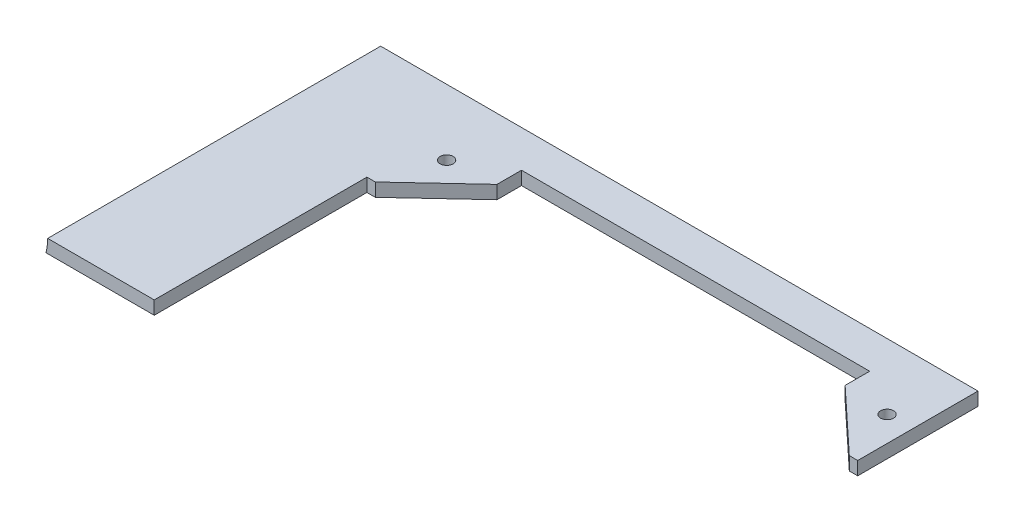
from build123d import *

# Parameters (mm, degrees)
SKETCH1_W            = 190.5
SKETCH1_H            = 76.2
BOSS_EXTRUDE1_DEPTH  = 3.175
SKETCH2_R            = 1.545336663
CUT_EXTRUDE4_DEPTH   = 103.636509708
SKETCH3_W            = 153.75
SKETCH3_H            = 3.175
BOSS_EXTRUDE2_DEPTH  = 3.175
CUT_SWEEP1_PROFILE_R = 12.7


with BuildPart() as part:
    # Sketch1 → Boss-Extrude1 (new body)
    with BuildSketch(Plane(origin=(0, 0, 0), x_dir=(1, 0, 0), z_dir=(0, 1, 0))):
        Rectangle(SKETCH1_W, SKETCH1_H)
    extrude(amount=BOSS_EXTRUDE1_DEPTH)

    # Sketch2 → Cut-Extrude4 (cut, through all)
    with BuildSketch(Plane(origin=(0, 3.175, 0), x_dir=(1, 0, 0), z_dir=(0, 1, 0))):
        Polygon((-58.5, 12.6), (-58.5, -38.1), (95.25, -38.1), (95.25, 38.1), (58.5, 38.1), (58.5, 12.6), (56.5, 12.6), (41.5, 26.6), (41.5, 32.45), (-41.5, 32.45), (-41.5, 26.6), (-56.5, 12.6), align=None)
        with Locations((-52.505245516, 25.605245516)):
            Circle(SKETCH2_R)
        with Locations((52.5, 25.605245516)):
            Circle(SKETCH2_R)
    extrude(amount=-CUT_EXTRUDE4_DEPTH, mode=Mode.SUBTRACT)

    # Sketch3 → Boss-Extrude2 (add)
    with BuildSketch(Plane(origin=(0, 0, -38.1), x_dir=(-1, 0, 0), z_dir=(0, 0, -1))):
        with Locations((18.375, 1.5875)):
            Rectangle(SKETCH3_W, SKETCH3_H)
    extrude(amount=BOSS_EXTRUDE2_DEPTH)

    # Cut-Sweep1: sweep along a curve in space
    with BuildLine() as cut_sweep1_path:
        Line((-96.6, 3.175, 467.883912637), (-96.6, 3.175, -36.654630794))
        Line((-96.6, 3.175, -36.654630794), (-96.6, 3.175, -207.159673584))
    # Cut-Sweep1 profile (on start of the path) → Cut-Sweep1 (sweep, cut)
    with BuildSketch(Plane(origin=(-96.6, 3.175, 467.883912637), x_dir=(0, -1, 0), z_dir=(0, 0, -1))):
        Circle(CUT_SWEEP1_PROFILE_R)
    sweep(path=cut_sweep1_path.line, mode=Mode.SUBTRACT)


solid = part.part
